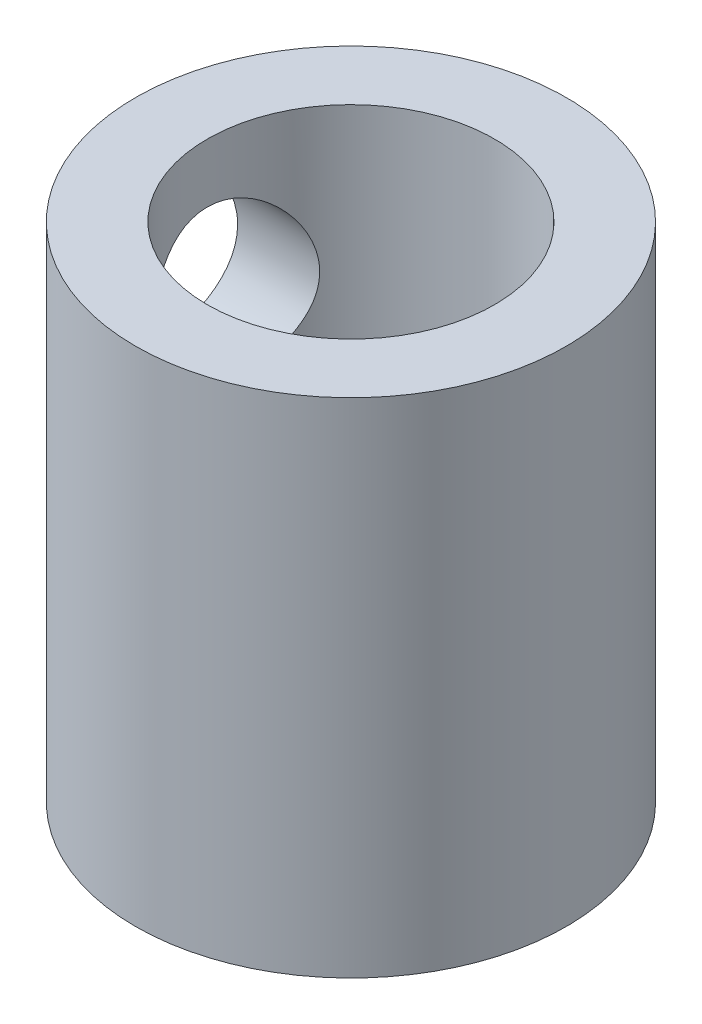
from build123d import *

# Parameters (mm, degrees)
SKETCH1_R           = 15
SKETCH1_R_2         = 10
BOSS_EXTRUDE1_DEPTH = 35
CUT_EXTRUDE1_REACH  = 42.927
SKETCH3_R           = 5.9


with BuildPart() as part:
    # Sketch1 → Boss-Extrude1 (new body)
    with BuildSketch(Plane(origin=(0, 0, 0), x_dir=(1, 0, 0), z_dir=(0, 1, 0))):
        Circle(SKETCH1_R)
        Circle(SKETCH1_R_2, mode=Mode.SUBTRACT)
    extrude(amount=BOSS_EXTRUDE1_DEPTH)

    # Sketch3 → Cut-Extrude1 (cut, up to next)
    with BuildSketch(Plane(origin=(0, 0, 0), x_dir=(0, 0, -1), z_dir=(1, 0, 0)), mode=Mode.PRIVATE) as cut_extrude1_sk1:
        with Locations((0, 25)):
            Circle(SKETCH3_R)
    cut_extrude1_tool1 = extrude(cut_extrude1_sk1.sketch, amount=-CUT_EXTRUDE1_REACH, mode=Mode.PRIVATE) & part.part
    add(cut_extrude1_tool1.solids().sort_by_distance((0, 25, 0))[0], mode=Mode.SUBTRACT)


solid = part.part
